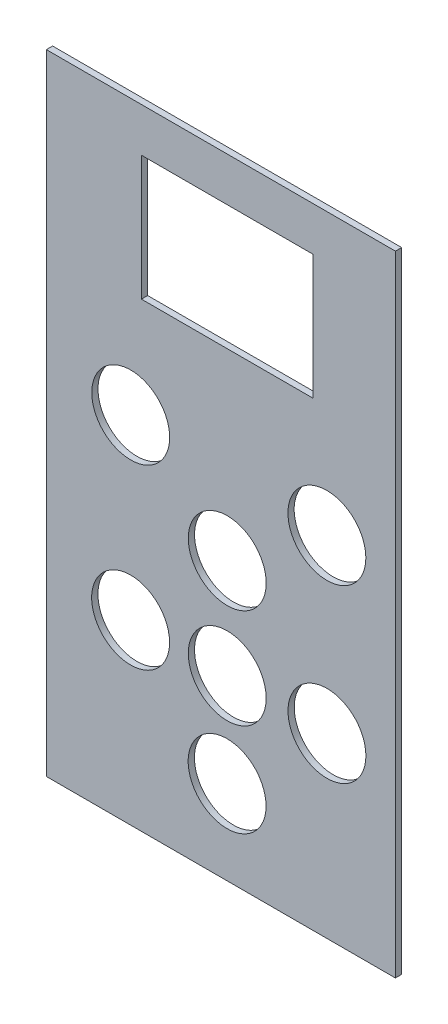
from build123d import *

# Parameters (mm, degrees)
SKETCH_1_W      = 56
SKETCH_1_H      = 101
SKETCH_1_R      = 6.25
SKETCH_1_W_2    = 27.5
SKETCH_1_H_2    = 20
EXTRUDE_1_DEPTH = 1


with BuildPart() as part:
    # 草图1 → 凸台-拉伸1 (new body)
    with BuildSketch(Plane.XY):
        with Locations((38.638295665, -46.39388964)):
            Rectangle(SKETCH_1_W, SKETCH_1_H)
        with Locations((39.638295665, -83.39388964)):
            Circle(SKETCH_1_R, mode=Mode.SUBTRACT)
        with Locations((39.655600692, -68.393899622)):
            Circle(SKETCH_1_R, mode=Mode.SUBTRACT)
        with Locations((24.155668166, -68.39388964)):
            Circle(SKETCH_1_R, mode=Mode.SUBTRACT)
        with Locations((55.65553532, -68.39388964)):
            Circle(SKETCH_1_R, mode=Mode.SUBTRACT)
        with Locations((39.659263627, -52.393900042)):
            Circle(SKETCH_1_R, mode=Mode.SUBTRACT)
        with Locations((55.646281128, -40.893891197)):
            Circle(SKETCH_1_R, mode=Mode.SUBTRACT)
        with Locations((24.170922732, -39.893893723)):
            Circle(SKETCH_1_R, mode=Mode.SUBTRACT)
        with Locations((39.638295665, -12.93988964)):
            Rectangle(SKETCH_1_W_2, SKETCH_1_H_2, mode=Mode.SUBTRACT)
    extrude(amount=EXTRUDE_1_DEPTH)


solid = part.part
